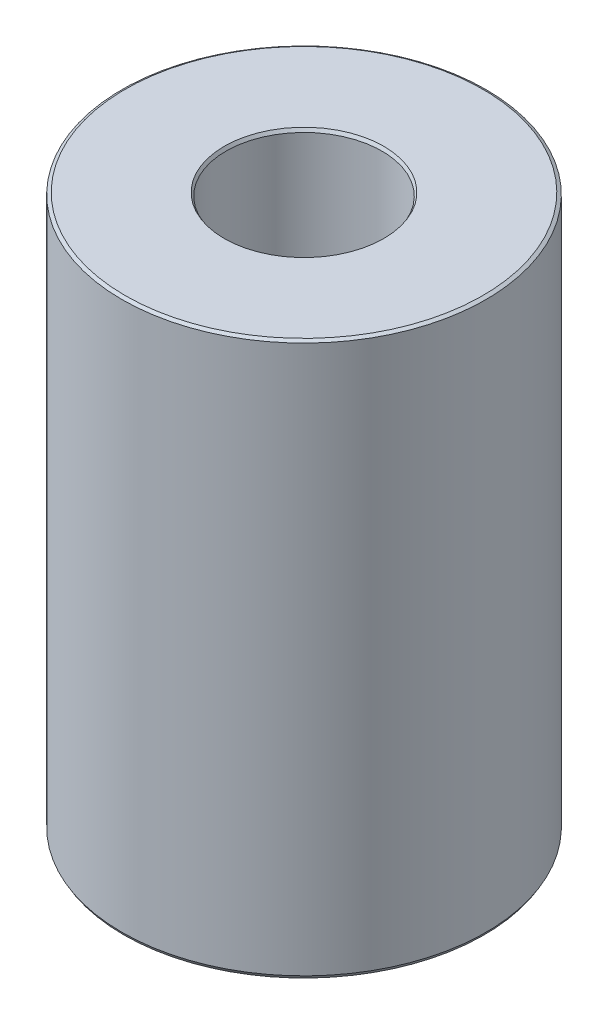
from build123d import *
from OCP.BRepFilletAPI import BRepFilletAPI_MakeChamfer

# Parameters (mm, degrees)
SKETCH1_R           = 55
BOSS_EXTRUDE1_DEPTH = 167.163065346
SKETCH2_R           = 23.577718863
CUT_EXTRUDE1_DEPTH  = 185.373236713
CHAMFER1_SIZE       = 0.557305975
CHAMFER1_SIZE2      = 0.965282264


with BuildPart() as part:
    # Sketch1 → Boss-Extrude1 (new body)
    with BuildSketch(Plane(origin=(0, 0, 0), x_dir=(1, 0, 0), z_dir=(0, 1, 0))):
        Circle(SKETCH1_R)
    extrude(amount=BOSS_EXTRUDE1_DEPTH)

    # Sketch2 → Cut-Extrude1 (cut, through all)
    with BuildSketch(Plane(origin=(0, 0, 0), x_dir=(1, 0, 0), z_dir=(0, 1, 0))):
        Circle(SKETCH2_R)
    extrude(amount=CUT_EXTRUDE1_DEPTH, mode=Mode.SUBTRACT)

    # Chamfer1: one chamfer whose edges measure the first distance from different faces: ONE call of the kernel's chamfer builder (chamfer() names one face for all edges)
    chamfer1_edges_1 = [part.edges().sort_by_distance(p)[0] for p in [
        (-23.577718863, 167.163065346, 0),
    ]]
    chamfer1_side_1 = [part.faces().sort_by_distance(p)[0] for p in [
        (-53.444365081, 167.163065346, 0),
    ]]
    chamfer1_edges_2 = [part.edges().sort_by_distance(p)[0] for p in [
        (-23.577718863, 0, 0),
    ]]
    chamfer1_side_2 = [part.faces().sort_by_distance(p)[0] for p in [
        (-23.577718863, 83.581532673, 0),
    ]]
    chamfer1_edges_3 = [part.edges().sort_by_distance(p)[0] for p in [
        (-55, 0, 0),
    ]]
    chamfer1_side_3 = [part.faces().sort_by_distance(p)[0] for p in [
        (-53.444365081, 0, 0),
    ]]
    chamfer1_edges_4 = [part.edges().sort_by_distance(p)[0] for p in [
        (-55, 167.163065346, 0),
    ]]
    chamfer1_side_4 = [part.faces().sort_by_distance(p)[0] for p in [
        (-55, 83.581532673, 0),
    ]]
    chamfer1 = BRepFilletAPI_MakeChamfer(part.part.solid().wrapped)
    for e in chamfer1_edges_1:
        chamfer1.Add(CHAMFER1_SIZE, CHAMFER1_SIZE2, e.wrapped, chamfer1_side_1[0].wrapped)  # the first distance lies on this face
    for e in chamfer1_edges_2:
        chamfer1.Add(CHAMFER1_SIZE, CHAMFER1_SIZE2, e.wrapped, chamfer1_side_2[0].wrapped)  # the first distance lies on this face
    for e in chamfer1_edges_3:
        chamfer1.Add(CHAMFER1_SIZE, CHAMFER1_SIZE2, e.wrapped, chamfer1_side_3[0].wrapped)  # the first distance lies on this face
    for e in chamfer1_edges_4:
        chamfer1.Add(CHAMFER1_SIZE, CHAMFER1_SIZE2, e.wrapped, chamfer1_side_4[0].wrapped)  # the first distance lies on this face
    add(Compound.cast(chamfer1.Shape()), mode=Mode.REPLACE)


solid = part.part
